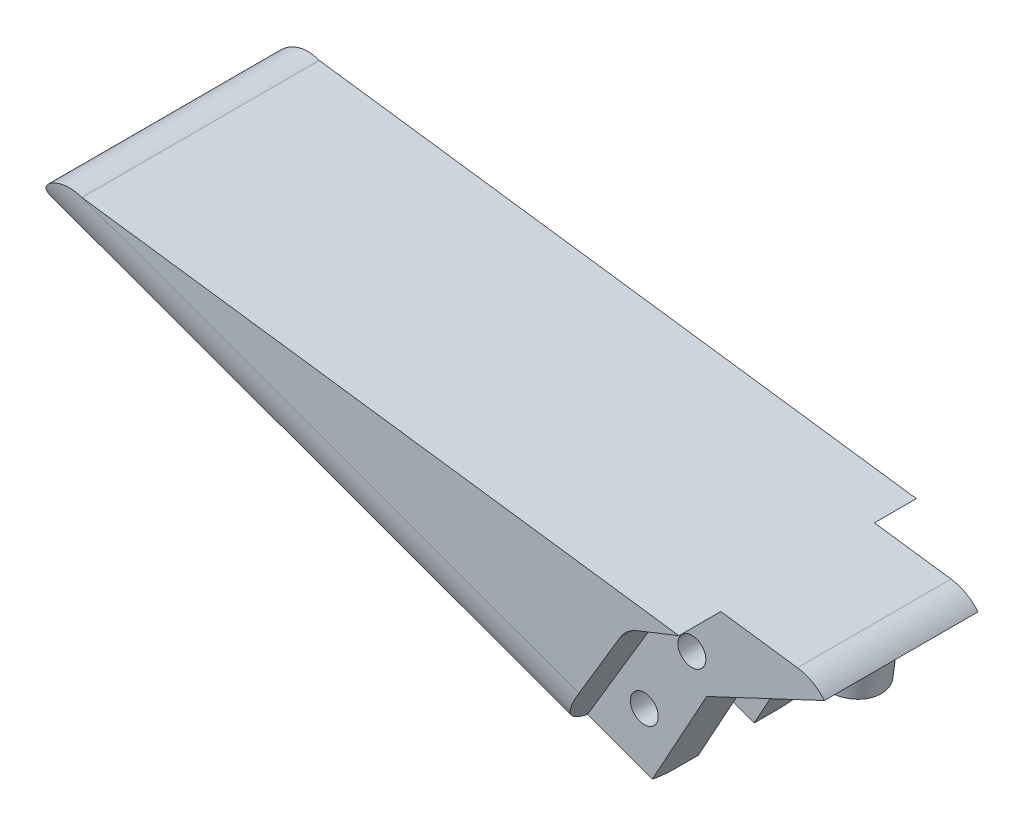
from build123d import *

# Parameters (mm, degrees)
SKETCH1_R           = 1
BOSS_EXTRUDE1_DEPTH = 17
CUT_EXTRUDE1_DEPTH  = 2
CUT_EXTRUDE2_DEPTH  = 3
CUT_EXTRUDE3_DEPTH  = 94.116031007
SKETCH5_R           = 2
SKETCH5_R_2         = 1
BOSS_EXTRUDE2_DEPTH = 3
FILLET1_START       = -84
FILLET1_DEPTH       = 46.103039735


with BuildPart() as part:
    # Sketch1 → Boss-Extrude1 (new body)
    with BuildSketch(Plane.XY):
        with BuildLine():
            Line((-12.561010035, 47.693103213), (-11.089724337, 53.437595852))
            Line((-11.089724337, 53.437595852), (-10.698403568, 54.965469926))
            ThreePointArc((-10.698403568, 54.965469926), (-11.120792406, 57.392279847), (-13.217767636, 58.684763351))
            Line((-13.217767636, 58.684763351), (-61.454584691, 65.227631075))
            ThreePointArc((-61.454584691, 65.227631075), (-64.658763624, 63.733229066), (-63.164361616, 60.529050133))
            Line((-63.164361616, 60.529050133), (-50.545614142, 55.937186437))
            Line((-50.545614142, 55.937186437), (-41.148452258, 52.517632588))
            Line((-41.148452258, 52.517632588), (-25.57571408, 46.850834736))
            Line((-25.57571408, 46.850834736), (-16.767387766, 43.645553554))
            ThreePointArc((-16.767387766, 43.645553554), (-14.456681284, 43.934299556), (-13.048668569, 45.789087654))
            Line((-13.048668569, 45.789087654), (-12.561010035, 47.693103213))
        make_face()
        with BuildLine():
            ThreePointArc((-23.185784758, 50.67045315), (-23.612180096, 49.851320869), (-24.527740143, 49.730736961))
            ThreePointArc((-24.527740143, 49.730736961), (-24.759389419, 51.48958543), (-23.185784758, 50.67045315))
        make_face(mode=Mode.SUBTRACT)
        with Locations((-20.777036606, 55.918720799)):
            Circle(SKETCH1_R, mode=Mode.SUBTRACT)
    extrude(amount=BOSS_EXTRUDE1_DEPTH)

    # Sketch2 → Cut-Extrude1 (cut, symmetric)
    with BuildSketch(Plane.XY.offset(8.5)):
        with BuildLine():
            Line((-24.51171166, 53.149116429), (-10.698403568, 54.965469926))
            Line((-10.698403568, 54.965469926), (-6.677815913, 55.49414911))
            Line((-6.677815913, 55.49414911), (-11.161264417, 41.454335722))
            Line((-11.161264417, 41.454335722), (-26.685784758, 44.980900868))
            Line((-26.685784758, 44.980900868), (-26.685784758, 47.009961102))
            Line((-26.685784758, 47.009961102), (-26.685784758, 50.67045315))
            ThreePointArc((-26.685784758, 50.67045315), (-26.065255063, 52.318965016), (-24.51171166, 53.149116429))
        make_face()
    extrude(amount=CUT_EXTRUDE1_DEPTH, both=True, mode=Mode.SUBTRACT)

    # Sketch3 → Cut-Extrude2 (cut)
    with BuildSketch(Plane.XY.offset(17)):
        with BuildLine():
            Line((-22.923684774, 57.200087897), (-29.137926811, 46.789494935))
            Line((-29.137926811, 46.789494935), (-12.362720011, 40.045691857))
            Line((-12.362720011, 40.045691857), (-5.826442747, 57.795582407))
            Line((-5.826442747, 57.795582407), (-16.920124342, 60.134250419))
            Line((-16.920124342, 60.134250419), (-21.697201499, 58.243220007))
            ThreePointArc((-21.697201499, 58.243220007), (-22.396717667, 57.823092942), (-22.923684774, 57.200087897))
        make_face()
    cut_extrude2 = extrude(amount=-CUT_EXTRUDE2_DEPTH, mode=Mode.SUBTRACT)

    # Mirror1: Cut-Extrude2 across plane
    add(cut_extrude2.mirror(Plane.XY.offset(8.5)), mode=Mode.SUBTRACT)

    # Sketch4 → Cut-Extrude3 (cut, through all)
    with BuildSketch(Plane.XY.offset(14)):
        Polygon((-19.714121893, 53.655932185), (-10.079835615, 58.181509414), (-11.289444582, 40.128166079), (-24.564448807, 44.84188173), (-23.812093713, 46.209067053), (-22.172973595, 49.187688427), align=None)
    extrude(amount=-CUT_EXTRUDE3_DEPTH, mode=Mode.SUBTRACT)

    # Sketch5 → Boss-Extrude2 (add)
    with BuildSketch(Plane(origin=(7.039796384, 51.900387509, 0), x_dir=(0.9909258444107709, -0.13440971273981925, 0), z_dir=(0.13440971273981922, 0.9909258444107708, 0))):
        with Locations((-21.928372674, -8.5)):
            Circle(SKETCH5_R)
        with Locations(Location((-21.928372674, -8.5, 0), (0, 0, 180))):
            Circle(SKETCH5_R_2, mode=Mode.SUBTRACT)
    extrude(amount=BOSS_EXTRUDE2_DEPTH)

    # Fillet1: read off the stored shape, not the designer's step
    # Fillet1 outline → Fillet1 (cut)
    with BuildSketch(Plane(origin=(0, 0, 0), x_dir=(0.34195538491818894, 0.939716188391715, 0), z_dir=(0.939716188391715, -0.341955384918189, 0)).offset(FILLET1_START)):
        with BuildLine():
            ThreePointArc((35.280734689, 12), (36.74520179, 15.535534913), (40.280737537, 17))
            Line((40.280737537, 17), (35.280734689, 17))
            Line((35.280734689, 17), (35.280734689, 12))
        make_face()
        with BuildLine():
            Line((35.280734689, 5), (35.280734689, 0))
            Line((35.280734689, 0), (40.280737537, 0))
            ThreePointArc((40.280737537, 0), (36.74520179, 1.464465087), (35.280734689, 5))
        make_face()
    extrude(amount=FILLET1_DEPTH, mode=Mode.SUBTRACT)


solid = part.part
